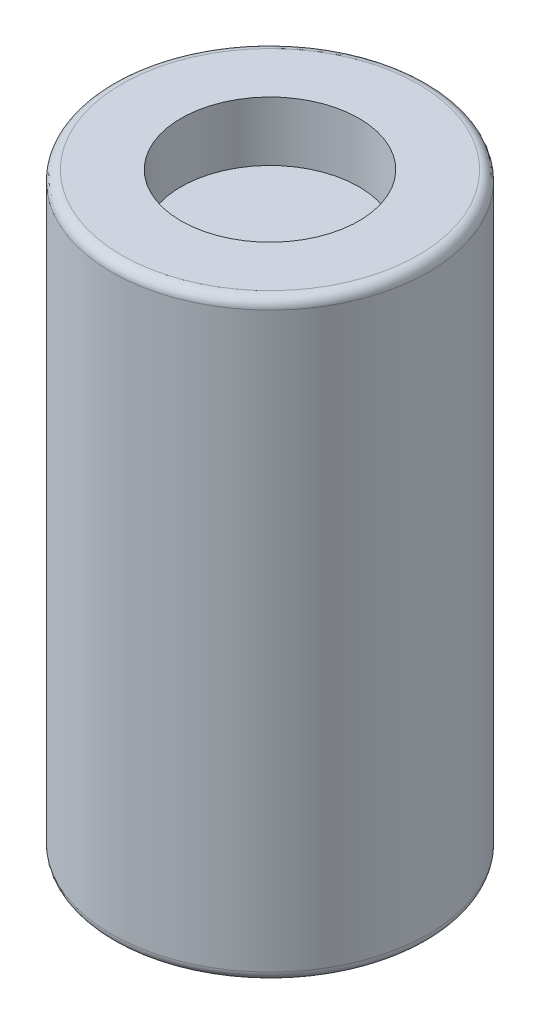
from build123d import *

# Parameters (mm, degrees)
SKETCH1_R           = 25.4
BOSS_EXTRUDE1_DEPTH = 95.25
FILLET1_R           = 1.5875
SKETCH2_R           = 14.2875
CUT_EXTRUDE1_DEPTH  = 9.525
CUT_EXTRUDE2_START  = -9.525
SKETCH3_R           = 14.2875
CUT_EXTRUDE2_DEPTH  = 9.525


with BuildPart() as part:
    # Sketch1 → Boss-Extrude1 (new body)
    with BuildSketch(Plane(origin=(0, 0, 0), x_dir=(1, 0, 0), z_dir=(0, 1, 0))):
        Circle(SKETCH1_R)
    extrude(amount=BOSS_EXTRUDE1_DEPTH)

    # Fillet1
    fillet1_edges = [part.edges().sort_by_distance(p)[0] for p in [
        (-25.4, 0, 0),
        (-25.4, 95.25, 0),
    ]]
    fillet(fillet1_edges, radius=FILLET1_R)

    # Sketch2 → Cut-Extrude1 (cut)
    with BuildSketch(Plane(origin=(0, 95.25, 0), x_dir=(1, 0, 0), z_dir=(0, 1, 0))):
        Circle(SKETCH2_R)
    extrude(amount=-CUT_EXTRUDE1_DEPTH, mode=Mode.SUBTRACT)

    # Sketch3 → Cut-Extrude2 (cut)
    with BuildSketch(Plane.XZ.offset(CUT_EXTRUDE2_START)):
        Circle(SKETCH3_R)
    extrude(amount=CUT_EXTRUDE2_DEPTH, mode=Mode.SUBTRACT)


solid = part.part
